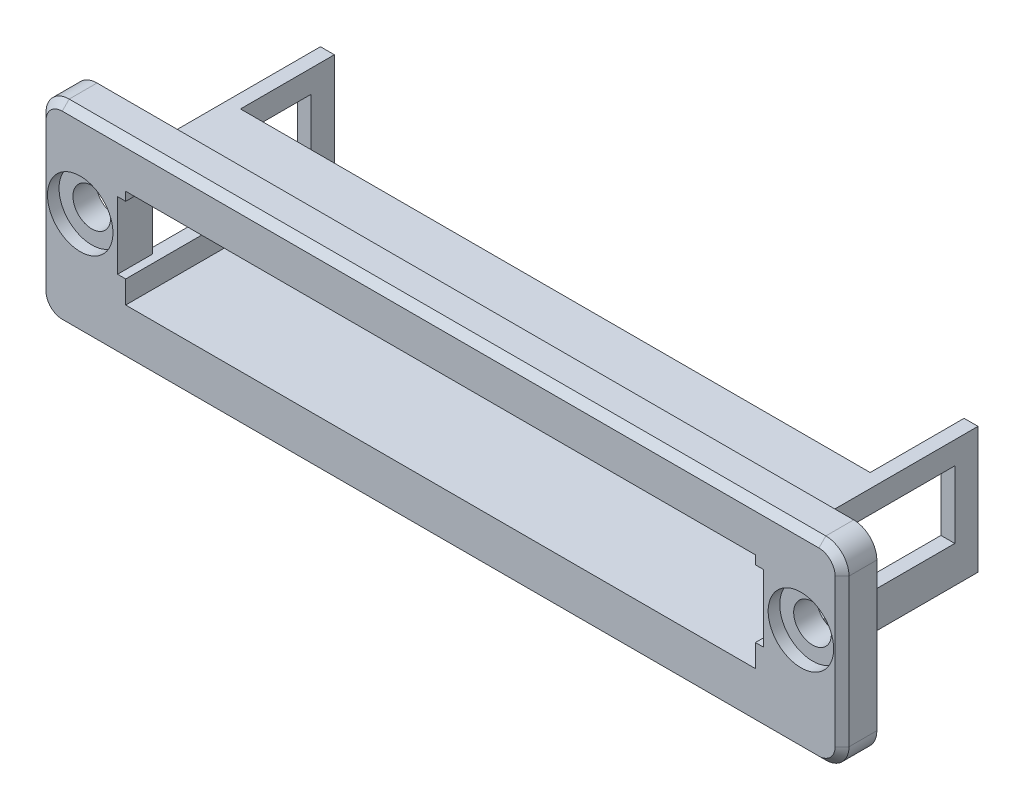
from build123d import *

# Parameters (mm, degrees)
FLANGE_DEPTH             = 3
FRONT_BEVEL_SIZE         = 0.6
OPENING_HOLES_DEPTH      = 36.974236962
OPENING_HOLES_DEPTH_BACK = 36.974236962
SK_OPENING_R             = 1.625
SK_COUNTERBORE_R         = 2.825
COUNTERBORE_DEPTH        = 1
SK_LONG_WALLS_W          = 56.72
SK_LONG_WALLS_H          = 1.2
LONG_WALLS_DEPTH         = 6.9
SK_LEGS_W                = 1.2
SK_LEGS_H                = 1.95
SK_LEGS_H_2              = 3.15
LEGS_DEPTH               = 13
SK_LEG_TIES_W            = 1.2
SK_LEG_TIES_H            = 10.9
LEG_TIES_DEPTH           = 2


with BuildPart() as part:
    # SK Flange → Flange (new body)
    with BuildSketch(Plane.XY):
        with BuildLine():
            Line((-32.635, -9.25), (32.635, -9.25))
            ThreePointArc((32.635, -9.25), (34.049213562, -8.664213562), (34.635, -7.25))
            Line((34.635, -7.25), (34.635, 5.5))
            ThreePointArc((34.635, 5.5), (34.049213562, 6.914213562), (32.635, 7.5))
            Line((32.635, 7.5), (-32.635, 7.5))
            ThreePointArc((-32.635, 7.5), (-34.049213562, 6.914213562), (-34.635, 5.5))
            Line((-34.635, 5.5), (-34.635, -7.25))
            ThreePointArc((-34.635, -7.25), (-34.049213562, -8.664213562), (-32.635, -9.25))
        make_face()
    extrude(amount=FLANGE_DEPTH)

    # Front bevel
    front_bevel_edges = [part.edges().sort_by_distance(p)[0] for p in [
        (-34.635, -0.875, 3),
        (-34.049213562, 6.914213562, 3),
        (0, 7.5, 3),
        (34.049213562, 6.914213562, 3),
        (34.635, -0.875, 3),
        (34.049213562, -8.664213562, 3),
        (0, -9.25, 3),
        (-34.049213562, -8.664213562, 3),
    ]]
    chamfer(front_bevel_edges, length=FRONT_BEVEL_SIZE)

    # SK Opening → Opening + holes (cut, two sides: drawn at the far end of the back side and taken through both)
    with BuildSketch(Plane.XY.offset(-OPENING_HOLES_DEPTH_BACK)):
        with Locations((-31.085, 0)):
            Circle(SK_OPENING_R)
        with Locations((31.085, 0)):
            Circle(SK_OPENING_R)
        Polygon((-27.16, -4.85), (27.16, -4.85), (27.16, -2.9), (27.86, -2.9), (27.86, 2.9), (27.16, 2.9), (27.16, 3.65), (-27.16, 3.65), (-27.16, 2.9), (-27.86, 2.9), (-27.86, -2.9), (-27.16, -2.9), align=None)
    extrude(amount=OPENING_HOLES_DEPTH + OPENING_HOLES_DEPTH_BACK, mode=Mode.SUBTRACT)

    # SK Counterbore → Counterbore (cut)
    with BuildSketch(Plane.XY.offset(3)):
        with Locations((-31.085, 0)):
            Circle(SK_COUNTERBORE_R)
        with Locations((31.085, 0)):
            Circle(SK_COUNTERBORE_R)
    extrude(amount=-COUNTERBORE_DEPTH, mode=Mode.SUBTRACT)

    # SK Long walls → Long walls (add)
    with BuildSketch(Plane.XY):
        with Locations((0, 4.25)):
            Rectangle(SK_LONG_WALLS_W, SK_LONG_WALLS_H)
        with Locations((0, -5.45)):
            Rectangle(SK_LONG_WALLS_W, SK_LONG_WALLS_H)
    extrude(amount=-LONG_WALLS_DEPTH)

    # SK Legs → Legs (add)
    with BuildSketch(Plane.XY):
        with Locations((-27.76, 3.875)):
            Rectangle(SK_LEGS_W, SK_LEGS_H)
        with Locations((-27.76, -4.475)):
            Rectangle(SK_LEGS_W, SK_LEGS_H_2)
        with Locations((27.76, 3.875)):
            Rectangle(SK_LEGS_W, SK_LEGS_H)
        with Locations((27.76, -4.475)):
            Rectangle(SK_LEGS_W, SK_LEGS_H_2)
    extrude(amount=-LEGS_DEPTH)

    # SK Leg ties → Leg ties (add)
    with BuildSketch(Plane.XY.offset(-13)):
        with Locations((-27.76, -0.6)):
            Rectangle(SK_LEG_TIES_W, SK_LEG_TIES_H)
        with Locations((27.76, -0.6)):
            Rectangle(SK_LEG_TIES_W, SK_LEG_TIES_H)
    extrude(amount=-LEG_TIES_DEPTH)


solid = part.part
